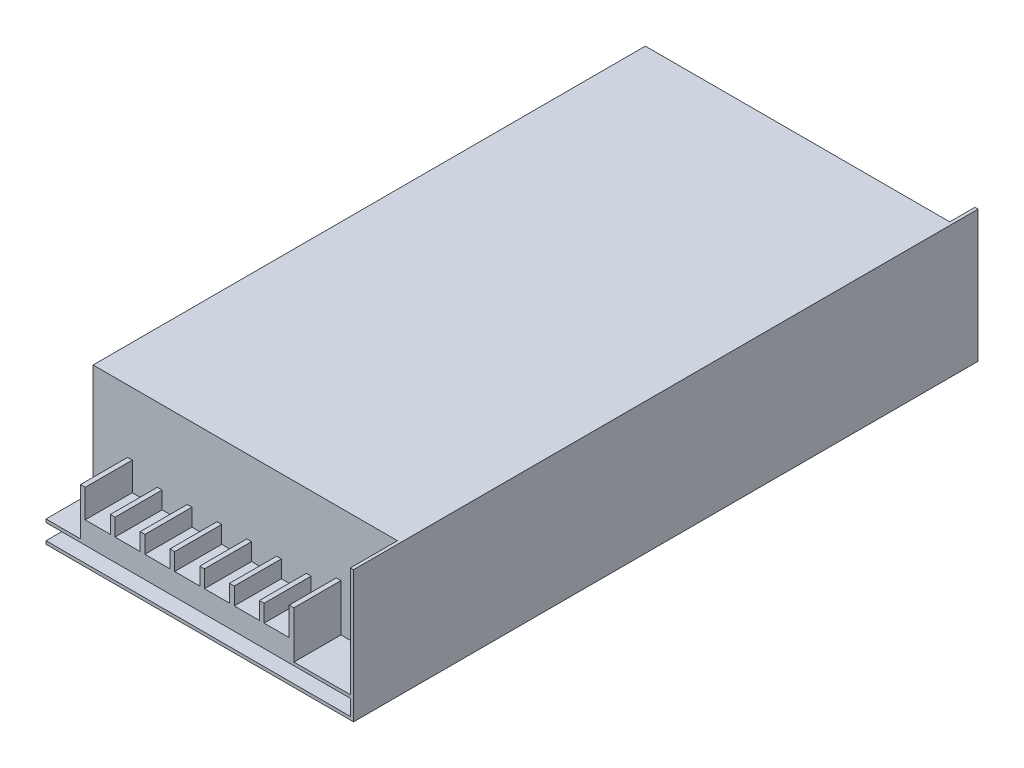
from build123d import *

# Parameters (mm, degrees)
SKETCH1_W           = 98
SKETCH1_H           = 199
BOSS_EXTRUDE1_DEPTH = 42
SKETCH3_R           = 1.5
CUT_EXTRUDE1_DEPTH  = 3
SKETCH4_W           = 97
SKETCH4_H           = 8
CUT_EXTRUDE2_DEPTH  = 41
SKETCH5_W           = 97
SKETCH5_H           = 15
CUT_EXTRUDE3_DEPTH  = 41
BOSS_EXTRUDE2_DEPTH = 15


with BuildPart() as part:
    # Sketch1 → Boss-Extrude1 (new body)
    with BuildSketch(Plane(origin=(0, 0, 0), x_dir=(1, 0, 0), z_dir=(0, 1, 0))):
        Rectangle(SKETCH1_W, SKETCH1_H)
    extrude(amount=BOSS_EXTRUDE1_DEPTH)

    # Sketch3 → Cut-Extrude1 (cut)
    with BuildSketch(Plane.XZ):
        with Locations((-40.5, 38.5)):
            Circle(SKETCH3_R)
        with Locations((39.5, 38.5)):
            Circle(SKETCH3_R)
        with Locations((-40.5, -81.5)):
            Circle(SKETCH3_R)
        with Locations((39.5, -81.5)):
            Circle(SKETCH3_R)
    extrude(amount=-CUT_EXTRUDE1_DEPTH, mode=Mode.SUBTRACT)

    # Sketch4 → Cut-Extrude2 (cut)
    with BuildSketch(Plane(origin=(0, 42, 0), x_dir=(1, 0, 0), z_dir=(0, 1, 0))):
        with Locations((-0.5, 95.5)):
            Rectangle(SKETCH4_W, SKETCH4_H)
    extrude(amount=-CUT_EXTRUDE2_DEPTH, mode=Mode.SUBTRACT)

    # Sketch5 → Cut-Extrude3 (cut)
    with BuildSketch(Plane(origin=(0, 42, 0), x_dir=(1, 0, 0), z_dir=(0, 1, 0))):
        with Locations((-0.5, -92)):
            Rectangle(SKETCH5_W, SKETCH5_H)
    extrude(amount=-CUT_EXTRUDE3_DEPTH, mode=Mode.SUBTRACT)

    # Sketch6 → Boss-Extrude2 (add)
    with BuildSketch(Plane.XY.offset(84.5)):
        Polygon((-49, 6), (48, 6), (48, 7), (30, 7), (30, 13), (30, 22), (28.5, 22), (28.5, 13), (20.5, 13), (20.5, 18.5), (19, 18.5), (19, 13), (11, 13), (11, 18.5), (9.5, 18.5), (9.5, 13), (1.5, 13), (1.5, 18.5), (0, 18.5), (0, 13), (-8, 13), (-8, 18.5), (-9.5, 18.5), (-9.5, 13), (-17.5, 13), (-17.5, 18.5), (-19, 18.5), (-19, 13), (-27, 13), (-27, 18.5), (-28.5, 18.5), (-28.5, 13), (-36.5, 13), (-36.5, 22), (-38, 22), (-38, 13), (-38, 7), (-49, 7), align=None)
    extrude(amount=BOSS_EXTRUDE2_DEPTH)


solid = part.part
